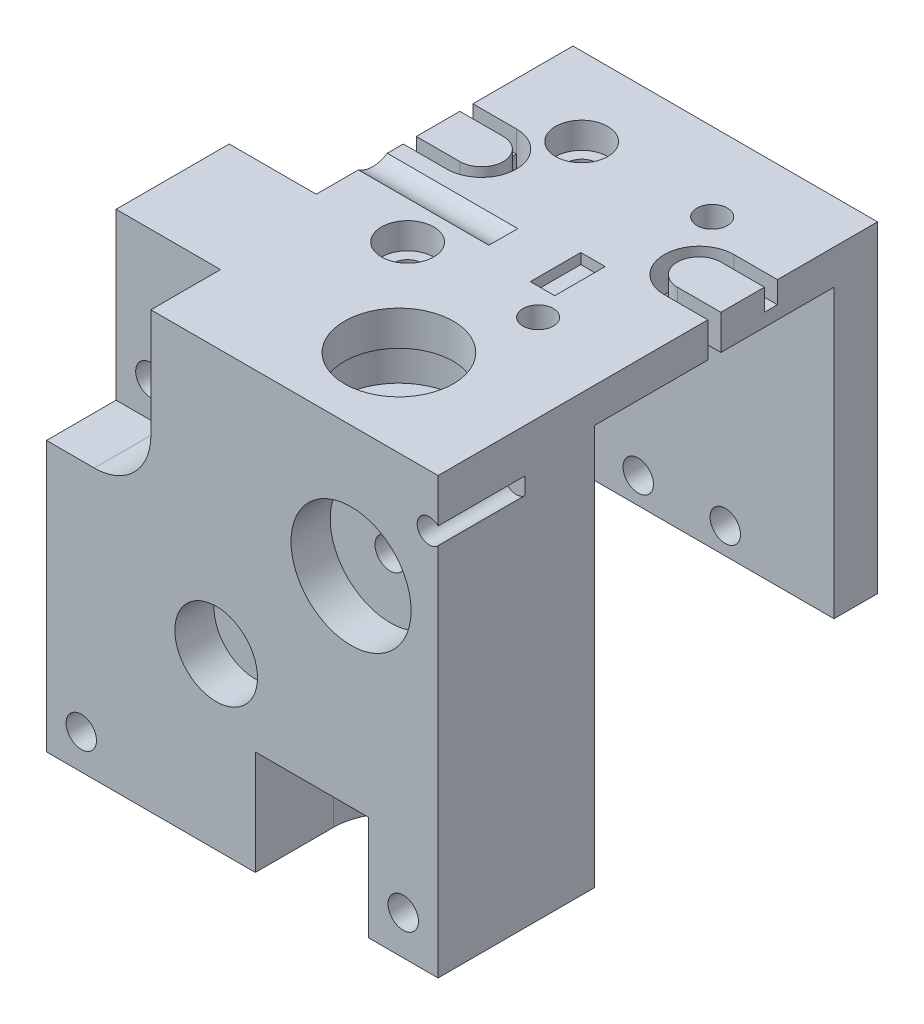
from build123d import *

# Parameters (mm, degrees)
SKETCH1_W                = 35
SKETCH1_H                = 28
BOSS_EXTRUDE1_DEPTH      = 4
SKETCH2_R                = 1.75
CUT_EXTRUDE1_DEPTH       = 23.765104876
BOSS_EXTRUDE2_DEPTH      = 17.5
BOSS_EXTRUDE2_DEPTH_BACK = 0.5
SKETCH3_W                = 35
SKETCH3_H                = 50
SKETCH7_W                = 35
SKETCH7_H                = 37
BOSS_EXTRUDE3_DEPTH      = 5
SKETCH10_R               = 1.75
CUT_EXTRUDE6_DEPTH       = 5
SKETCH24_W               = 18
SKETCH24_H               = 46
BOSS_EXTRUDE4_DEPTH      = 10
SKETCH37_W               = 13
SKETCH37_H               = 14
BOSS_EXTRUDE9_DEPTH      = 10
CUT_EXTRUDE19_REACH      = 75.638
SKETCH22_R               = 1.75
SKETCH22_3_R             = 6.9
SKETCH22_3_R_2           = 4.75
CUT_EXTRUDE20_DEPTH      = 4.5
SKETCH22_5_R             = 1.75
SKETCH22_5_W             = 2
SKETCH22_5_H             = 4
CUT_EXTRUDE24_DEPTH      = 8
SKETCH22_4_W             = 13
SKETCH22_4_H             = 12
CUT_EXTRUDE21_DEPTH      = 15.5
FILLET3_R                = 6.5
SKETCH26_R               = 2.25
CUT_EXTRUDE22_DEPTH      = 57.502212346
SKETCH27_R               = 6.25
CUT_EXTRUDE23_DEPTH      = 8
CUT_EXTRUDE25_DEPTH      = 3
CUT_EXTRUDE25_DEPTH_BACK = 3
SKETCH30_R               = 3
CUT_EXTRUDE26_DEPTH      = 3
CUT_EXTRUDE27_DEPTH      = 66.180518562
SKETCH32_W               = 5
SKETCH32_H               = 1.5
CUT_EXTRUDE28_DEPTH      = 2.5
SKETCH33_R               = 3
CUT_EXTRUDE29_DEPTH      = 15
SKETCH34_W               = 2.8
SKETCH34_H               = 5.8
CUT_EXTRUDE30_DEPTH      = 1.2
SKETCH38_R               = 7
CUT_EXTRUDE31_DEPTH      = 4
SKETCH39_W               = 5
SKETCH39_H               = 13
SKETCH39_W_2             = 4
SKETCH39_H_2             = 7
CUT_EXTRUDE32_DEPTH      = 3
SKETCH40_R               = 1.4
CUT_EXTRUDE33_DEPTH      = 15
SKETCH41_R               = 1.25
BOSS_EXTRUDE10_DEPTH     = 2.5
SKETCH42_R               = 1.4
CUT_EXTRUDE34_DEPTH      = 10


with BuildPart() as part:
    # Sketch1 → Boss-Extrude1 (new body)
    with BuildSketch(Plane(origin=(0, 0, 0), x_dir=(1, 0, 0), z_dir=(0, 1, 0))):
        Rectangle(SKETCH1_W, SKETCH1_H)
    extrude(amount=BOSS_EXTRUDE1_DEPTH)

    # Sketch2 → Cut-Extrude1 (cut, through all)
    with BuildSketch(Plane(origin=(0, 4, 0), x_dir=(1, 0, 0), z_dir=(0, 1, 0))):
        with Locations(Location((-7.5, -10, 0), (0, 0, 270))):
            Circle(SKETCH2_R)
        with Locations(Location((-7.5, 10, 0), (0, 0, 270))):
            Circle(SKETCH2_R)
        with Locations(Location((7.5, -10, 0), (0, 0, 270))):
            Circle(SKETCH2_R)
        with Locations(Location((7.5, 10, 0), (0, 0, 270))):
            Circle(SKETCH2_R)
    extrude(amount=-CUT_EXTRUDE1_DEPTH, mode=Mode.SUBTRACT)

    # Sketch3 → Boss-Extrude2 (add, two sides: drawn at the far end of the back side and taken through both)
    with BuildSketch(Plane.XY.offset(14).offset(-BOSS_EXTRUDE2_DEPTH_BACK)):
        with Locations((0, -21)):
            Rectangle(SKETCH3_W, SKETCH3_H)
    extrude(amount=BOSS_EXTRUDE2_DEPTH + BOSS_EXTRUDE2_DEPTH_BACK)

    # Sketch7 → Boss-Extrude3 (add)
    with BuildSketch(Plane(origin=(0, 0, -14), x_dir=(-1, 0, 0), z_dir=(0, 0, -1))):
        with Locations((0, -14.5)):
            Rectangle(SKETCH7_W, SKETCH7_H)
    extrude(amount=BOSS_EXTRUDE3_DEPTH)

    # Sketch10 → Cut-Extrude6 (cut)
    with BuildSketch(Plane(origin=(0, 0, -19), x_dir=(-1, 0, 0), z_dir=(0, 0, -1))):
        with Locations((-5, -30)):
            Circle(SKETCH10_R)
        with Locations((5, -30)):
            Circle(SKETCH10_R)
    extrude(amount=-CUT_EXTRUDE6_DEPTH, mode=Mode.SUBTRACT)

    # Sketch24 → Boss-Extrude4 (add)
    with BuildSketch(Plane.ZY.offset(17.5)):
        with Locations((22.5, -23)):
            Rectangle(SKETCH24_W, SKETCH24_H)
    extrude(amount=BOSS_EXTRUDE4_DEPTH)

    # Sketch37 → Boss-Extrude9 (add)
    with BuildSketch(Plane.ZY.offset(17.5)):
        with Locations((17, -3)):
            Rectangle(SKETCH37_W, SKETCH37_H)
    extrude(amount=BOSS_EXTRUDE9_DEPTH)

    # Sketch22 → Cut-Extrude19 (cut, up to next)
    with BuildSketch(Plane.XY.offset(31.5), mode=Mode.PRIVATE) as cut_extrude19_sk1:
        with Locations((-23.5, -42)):
            Circle(SKETCH22_R)
    cut_extrude19_tool1 = extrude(cut_extrude19_sk1.sketch, amount=-CUT_EXTRUDE19_REACH, mode=Mode.PRIVATE) & part.part
    # Sketch22 → Cut-Extrude19 (cut, up to next)
    with BuildSketch(Plane.XY.offset(31.5), mode=Mode.PRIVATE) as cut_extrude19_sk2:
        with Locations((13.5, -41.5)):
            Circle(SKETCH22_R)
    cut_extrude19_tool2 = extrude(cut_extrude19_sk2.sketch, amount=-CUT_EXTRUDE19_REACH, mode=Mode.PRIVATE) & part.part
    # Sketch22 → Cut-Extrude19 (cut, up to next)
    with BuildSketch(Plane.XY.offset(31.5), mode=Mode.PRIVATE) as cut_extrude19_sk3:
        with Locations((7.5, -11)):
            Circle(SKETCH22_R)
    cut_extrude19_tool3 = extrude(cut_extrude19_sk3.sketch, amount=-CUT_EXTRUDE19_REACH, mode=Mode.PRIVATE) & part.part
    # Sketch22 → Cut-Extrude19 (cut, up to next)
    with BuildSketch(Plane.XY.offset(31.5), mode=Mode.PRIVATE) as cut_extrude19_sk4:
        with Locations((-23.5, -11)):
            Circle(SKETCH22_R)
    cut_extrude19_tool4 = extrude(cut_extrude19_sk4.sketch, amount=-CUT_EXTRUDE19_REACH, mode=Mode.PRIVATE) & part.part
    add(cut_extrude19_tool1.solids().sort_by_distance((-23.5, -42, 31.5))[0], mode=Mode.SUBTRACT)
    add(cut_extrude19_tool2.solids().sort_by_distance((13.5, -41.5, 31.5))[0], mode=Mode.SUBTRACT)
    add(cut_extrude19_tool3.solids().sort_by_distance((7.5, -11, 31.5))[0], mode=Mode.SUBTRACT)
    add(cut_extrude19_tool4.solids().sort_by_distance((-23.5, -11, 31.5))[0], mode=Mode.SUBTRACT)

    # Sketch22<3> → Cut-Extrude20 (cut)
    with BuildSketch(Plane.XY.offset(31.5)):
        with Locations((7.5, -11)):
            Circle(SKETCH22_3_R)
        with Locations((-8, -26.5)):
            Circle(SKETCH22_3_R_2)
    extrude(amount=-CUT_EXTRUDE20_DEPTH, mode=Mode.SUBTRACT)

    # Sketch22<5> → Cut-Extrude24 (cut)
    # profile 1 of 2: a face of its own
    with BuildSketch(Plane.XY.offset(31.5)):
        with BuildLine():
            Line((-15.5, -8.5), (-15.5, 0))
            Line((-15.5, 0), (-17.5, 0))
            Line((-17.5, 0), (-27.5, 0))
            Line((-27.5, 0), (-27.5, -15))
            Line((-27.5, -15), (-22, -15))
            ThreePointArc((-22, -15), (-17.403805922, -13.096194078), (-15.5, -8.5))
        make_face()
        with Locations((-23.5, -11)):
            Circle(SKETCH22_5_R, mode=Mode.SUBTRACT)
    # profile 2 of 2: a face of its own
    with BuildSketch(Plane.XY.offset(31.5)):
        with Locations((-16.5, 2)):
            Rectangle(SKETCH22_5_W, SKETCH22_5_H)
    extrude(amount=-CUT_EXTRUDE24_DEPTH, mode=Mode.SUBTRACT)

    # Sketch22<4> → Cut-Extrude21 (cut)
    with BuildSketch(Plane.XY.offset(31.5)):
        with Locations((3, -40)):
            Rectangle(SKETCH22_4_W, SKETCH22_4_H)
    extrude(amount=-CUT_EXTRUDE21_DEPTH, mode=Mode.SUBTRACT)

    # Fillet3
    fillet3_edges = [part.edges().sort_by_distance(p)[0] for p in [
        (9.5, -40, 16),
        (-3.5, -40, 16),
    ]]
    fillet(fillet3_edges, radius=FILLET3_R - 0.0001)  # a hair under: the kernel refuses the full size

    # Sketch26 → Cut-Extrude22 (cut, through all)
    with BuildSketch(Plane.XZ.offset(34)):
        with Locations(Location((3, 21.5, 0), (0, 0, 270))):
            Circle(SKETCH26_R)
    extrude(amount=-CUT_EXTRUDE22_DEPTH, mode=Mode.SUBTRACT)

    # Sketch27 → Cut-Extrude23 (cut)
    with BuildSketch(Plane(origin=(0, 4, 0), x_dir=(1, 0, 0), z_dir=(0, 1, 0))):
        with Locations(Location((3, -21.5, 0), (0, 0, 270))):
            Circle(SKETCH27_R)
    extrude(amount=-CUT_EXTRUDE23_DEPTH, mode=Mode.SUBTRACT)

    # Sketch29 → Cut-Extrude25 (cut, two sides: drawn at the far end of the back side and taken through both)
    with BuildSketch(Plane(origin=(0, 0, 13.5), x_dir=(-1, 0, 0), z_dir=(0, 0, -1)).offset(-CUT_EXTRUDE25_DEPTH_BACK)):
        Polygon((-4.151368439, -11), (-5.825684219, -8.1), (-9.174315781, -8.1), (-10.848631561, -11), (-9.174315781, -13.9), (-5.825684219, -13.9), align=None)
        Polygon((20.151368439, -11), (21.825684219, -13.9), (25.174315781, -13.9), (26.848631561, -11), (25.174315781, -8.1), (21.825684219, -8.1), align=None)
        Polygon((-10.151368439, -41.5), (-11.825684219, -38.6), (-15.174315781, -38.6), (-16.848631561, -41.5), (-15.174315781, -44.4), (-11.825684219, -44.4), align=None)
        Polygon((23.5, -45.348631561), (26.4, -43.674315781), (26.4, -40.325684219), (23.5, -38.651368439), (20.6, -40.325684219), (20.6, -43.674315781), align=None)
    extrude(amount=CUT_EXTRUDE25_DEPTH + CUT_EXTRUDE25_DEPTH_BACK, mode=Mode.SUBTRACT)

    # Sketch30 → Cut-Extrude26 (cut)
    with BuildSketch(Plane(origin=(0, 4, 0), x_dir=(1, 0, 0), z_dir=(0, 1, 0))):
        with Locations(Location((-7.5, 10, 0), (0, 0, 270))):
            Circle(SKETCH30_R)
        with Locations(Location((-7.5, -10, 0), (0, 0, 270))):
            Circle(SKETCH30_R)
    extrude(amount=-CUT_EXTRUDE26_DEPTH, mode=Mode.SUBTRACT)

    # Sketch31 → Cut-Extrude27 (cut, through all)
    with BuildSketch(Plane(origin=(0, 4, 0), x_dir=(1, 0, 0), z_dir=(0, 1, 0))):
        with BuildLine():
            Line((-17.5, 1), (-12.5, 1))
            ThreePointArc((-12.5, 1), (-10, 3.5), (-12.5, 6))
            Line((-12.5, 6), (-12.5, 7.5))
            ThreePointArc((-12.5, 7.5), (-8.5, 3.5), (-12.5, -0.5))
            Line((-12.5, -0.5), (-17.5, -0.5))
            Line((-17.5, -0.5), (-17.5, 1))
        make_face()
    cut_extrude27 = extrude(amount=-CUT_EXTRUDE27_DEPTH, mode=Mode.SUBTRACT)

    # Sketch32 → Cut-Extrude28 (cut)
    with BuildSketch(Plane(origin=(0, 4, 0), x_dir=(1, 0, 0), z_dir=(0, 1, 0))):
        with Locations((-15, 6.75)):
            Rectangle(SKETCH32_W, SKETCH32_H)
    cut_extrude28 = extrude(amount=-CUT_EXTRUDE28_DEPTH, mode=Mode.SUBTRACT)

    # Sketch33 → Cut-Extrude29 (cut)
    with BuildSketch(Plane.ZY.offset(17.5)):
        with Locations((4, 6.5)):
            Circle(SKETCH33_R)
    extrude(amount=-CUT_EXTRUDE29_DEPTH, mode=Mode.SUBTRACT)

    # Sketch34 → Cut-Extrude30 (cut)
    with BuildSketch(Plane(origin=(0, 4, 0), x_dir=(1, 0, 0), z_dir=(0, 1, 0))):
        with Locations((4.9, -4)):
            Rectangle(SKETCH34_W, SKETCH34_H)
    extrude(amount=-CUT_EXTRUDE30_DEPTH, mode=Mode.SUBTRACT)

    # Mirror1: Cut-Extrude27, Cut-Extrude28 across plane
    add(cut_extrude27.mirror(Plane.ZY), mode=Mode.SUBTRACT)
    add(cut_extrude28.mirror(Plane.ZY), mode=Mode.SUBTRACT)

    # Sketch38 → Cut-Extrude31 (cut)
    with BuildSketch(Plane(origin=(0, -4, 0), x_dir=(1, 0, 0), z_dir=(0, 1, 0))):
        with Locations(Location((3, -21.5, 0), (0, 0, 270))):
            Circle(SKETCH38_R)
    extrude(amount=CUT_EXTRUDE31_DEPTH, mode=Mode.SUBTRACT)

    # Sketch39 → Cut-Extrude32 (cut)
    with BuildSketch(Plane.ZY.offset(27.5)):
        with Locations((16, -32.5)):
            Rectangle(SKETCH39_W, SKETCH39_H)
        with Locations((25.5, -32.5)):
            Rectangle(SKETCH39_W_2, SKETCH39_H_2)
    extrude(amount=-CUT_EXTRUDE32_DEPTH, mode=Mode.SUBTRACT)

    # Sketch40 → Cut-Extrude33 (cut)
    with BuildSketch(Plane.ZY.offset(27.5)):
        with Locations((17, -22.5)):
            Circle(SKETCH40_R)
    extrude(amount=-CUT_EXTRUDE33_DEPTH, mode=Mode.SUBTRACT)

    # Sketch41 → Boss-Extrude10 (add)
    with BuildSketch(Plane.ZY.offset(27.5)):
        with Locations(Location((17, -42.5, 0), (0, 0, 180))):
            Circle(SKETCH41_R)
        with BuildLine():
            Line((20.5, -39), (20.5, -42.5))
            ThreePointArc((20.5, -42.5), (19.474873734, -44.974873734), (17, -46))
            Line((17, -46), (21.873397172, -46))
            ThreePointArc((21.873397172, -46), (22.711408891, -44.338425545), (23, -42.5))
            Line((23, -42.5), (23, -39))
            Line((23, -39), (20.5, -39))
        make_face()
    extrude(amount=BOSS_EXTRUDE10_DEPTH)

    # Sketch42 → Cut-Extrude34 (cut)
    with BuildSketch(Plane.XY.offset(31.5)):
        with Locations((16.5, -2)):
            Circle(SKETCH42_R)
    extrude(amount=-CUT_EXTRUDE34_DEPTH, mode=Mode.SUBTRACT)


solid = part.part
